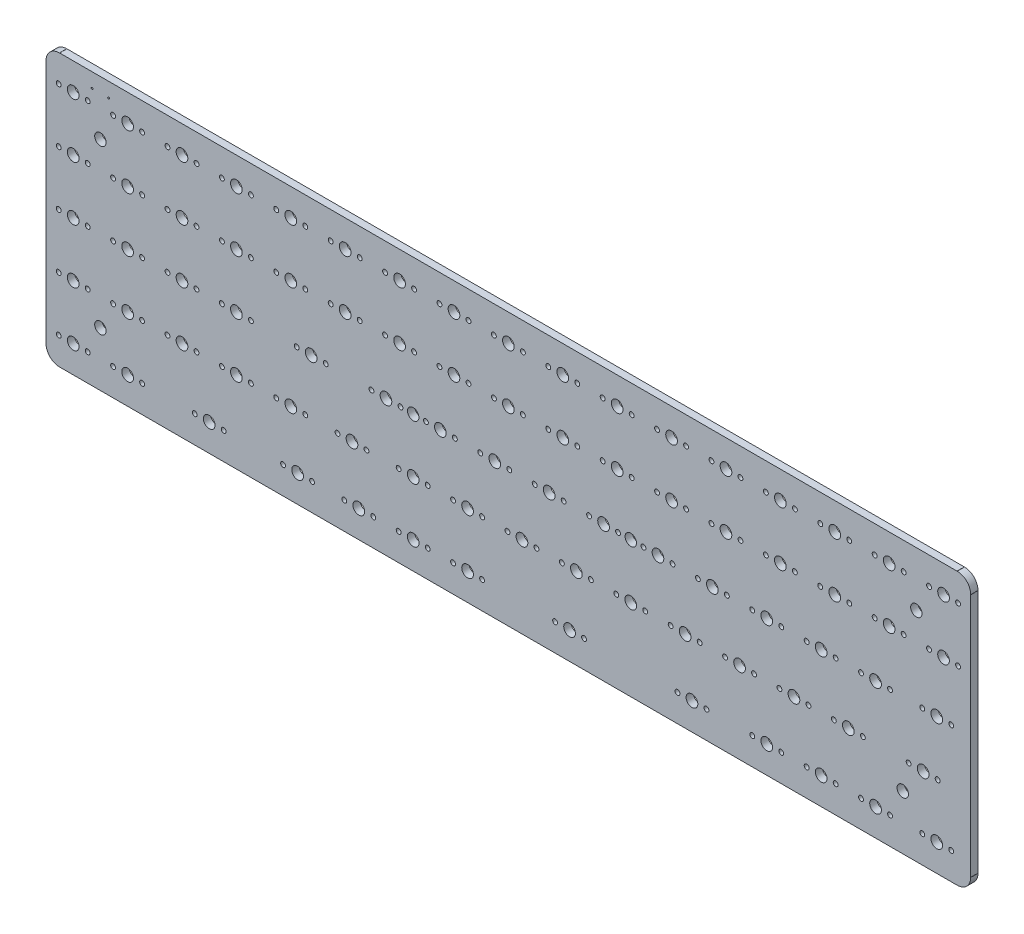
from build123d import *

# Parameters (mm, degrees)
SKETCH2_R           = 0.8534
SKETCH2_R_2         = 2.0447
SKETCH2_R_3         = 2
SKETCH2_R_4         = 0.325
BOSS_EXTRUDE3_DEPTH = 1.27


with BuildPart() as part:
    # Sketch2 → Boss-Extrude3 (new, symmetric)
    with BuildSketch(Plane.XY):
        with BuildLine():
            ThreePointArc((314.2869, -4.7625), (314.298059232, -4.735559232), (314.325, -4.7244))
            Line((314.325, -4.7244), (314.325, 80.9244))
            ThreePointArc((314.325, 80.9244), (314.298059232, 80.935559232), (314.2869, 80.9625))
            ThreePointArc((314.2869, 80.9625), (314.298005094, 80.989386522), (314.324846721, 81.000599692))
            ThreePointArc((314.324846721, 81.000599692), (312.93006375, 84.33006375), (309.600599692, 85.724846721))
            ThreePointArc((309.600599692, 85.724846721), (309.589386522, 85.698005094), (309.5625, 85.6869))
            ThreePointArc((309.5625, 85.6869), (309.535559232, 85.698059232), (309.5244, 85.725))
            Line((309.5244, 85.725), (-4.7244, 85.725))
            ThreePointArc((-4.7244, 85.725), (-4.735559232, 85.698059232), (-4.7625, 85.6869))
            ThreePointArc((-4.7625, 85.6869), (-4.789386522, 85.698005094), (-4.800599692, 85.724846721))
            ThreePointArc((-4.800599692, 85.724846721), (-8.13006375, 84.33006375), (-9.524846721, 81.000599692))
            ThreePointArc((-9.524846721, 81.000599692), (-9.498005094, 80.989386522), (-9.4869, 80.9625))
            ThreePointArc((-9.4869, 80.9625), (-9.498059232, 80.935559232), (-9.525, 80.9244))
            Line((-9.525, 80.9244), (-9.525, -4.7244))
            ThreePointArc((-9.525, -4.7244), (-9.498059232, -4.735559232), (-9.4869, -4.7625))
            ThreePointArc((-9.4869, -4.7625), (-9.498005094, -4.789386522), (-9.524846721, -4.800599692))
            ThreePointArc((-9.524846721, -4.800599692), (-8.13006375, -8.13006375), (-4.800599692, -9.524846721))
            ThreePointArc((-4.800599692, -9.524846721), (-4.789386522, -9.498005094), (-4.7625, -9.4869))
            ThreePointArc((-4.7625, -9.4869), (-4.735559232, -9.498059232), (-4.7244, -9.525))
            Line((-4.7244, -9.525), (309.5244, -9.525))
            ThreePointArc((309.5244, -9.525), (309.535559232, -9.498059232), (309.5625, -9.4869))
            ThreePointArc((309.5625, -9.4869), (309.589386522, -9.498005094), (309.600599692, -9.524846721))
            ThreePointArc((309.600599692, -9.524846721), (312.93006375, -8.13006375), (314.324846721, -4.800599692))
            ThreePointArc((314.324846721, -4.800599692), (314.298005094, -4.789386522), (314.2869, -4.7625))
        make_face()
        with Locations((-5.08, 0)):
            Circle(SKETCH2_R, mode=Mode.SUBTRACT)
        Circle(SKETCH2_R_2, mode=Mode.SUBTRACT)
        with Locations((5.08, 0)):
            Circle(SKETCH2_R, mode=Mode.SUBTRACT)
        with Locations((13.97, 0)):
            Circle(SKETCH2_R, mode=Mode.SUBTRACT)
        with Locations((19.05, 0)):
            Circle(SKETCH2_R_2, mode=Mode.SUBTRACT)
        with Locations((24.13, 0)):
            Circle(SKETCH2_R, mode=Mode.SUBTRACT)
        with Locations((42.545, 0)):
            Circle(SKETCH2_R, mode=Mode.SUBTRACT)
        with Locations((47.625, 0)):
            Circle(SKETCH2_R_2, mode=Mode.SUBTRACT)
        with Locations((52.705, 0)):
            Circle(SKETCH2_R, mode=Mode.SUBTRACT)
        with Locations((9.525, 9.525)):
            Circle(SKETCH2_R_3, mode=Mode.SUBTRACT)
        with Locations((73.5012, 0)):
            Circle(SKETCH2_R, mode=Mode.SUBTRACT)
        with Locations((78.5812, 0)):
            Circle(SKETCH2_R_2, mode=Mode.SUBTRACT)
        with Locations((83.6613, 0)):
            Circle(SKETCH2_R, mode=Mode.SUBTRACT)
        with Locations((94.9325, 0)):
            Circle(SKETCH2_R, mode=Mode.SUBTRACT)
        with Locations((100.0125, 0)):
            Circle(SKETCH2_R_2, mode=Mode.SUBTRACT)
        with Locations((105.0925, 0)):
            Circle(SKETCH2_R, mode=Mode.SUBTRACT)
        with Locations((113.9825, 0)):
            Circle(SKETCH2_R, mode=Mode.SUBTRACT)
        with Locations((119.0625, 0)):
            Circle(SKETCH2_R_2, mode=Mode.SUBTRACT)
        with Locations((124.1425, 0)):
            Circle(SKETCH2_R, mode=Mode.SUBTRACT)
        with Locations((133.0325, 0)):
            Circle(SKETCH2_R, mode=Mode.SUBTRACT)
        with Locations((138.1125, 0)):
            Circle(SKETCH2_R_2, mode=Mode.SUBTRACT)
        with Locations((143.1925, 0)):
            Circle(SKETCH2_R, mode=Mode.SUBTRACT)
        with Locations((-5.08, 19.05)):
            Circle(SKETCH2_R, mode=Mode.SUBTRACT)
        with Locations((0, 19.05)):
            Circle(SKETCH2_R_2, mode=Mode.SUBTRACT)
        with Locations((5.08, 19.05)):
            Circle(SKETCH2_R, mode=Mode.SUBTRACT)
        with Locations((13.97, 19.05)):
            Circle(SKETCH2_R, mode=Mode.SUBTRACT)
        with Locations((19.05, 19.05)):
            Circle(SKETCH2_R_2, mode=Mode.SUBTRACT)
        with Locations((24.13, 19.05)):
            Circle(SKETCH2_R, mode=Mode.SUBTRACT)
        with Locations((33.02, 19.05)):
            Circle(SKETCH2_R, mode=Mode.SUBTRACT)
        with Locations((38.1, 19.05)):
            Circle(SKETCH2_R_2, mode=Mode.SUBTRACT)
        with Locations((43.18, 19.05)):
            Circle(SKETCH2_R, mode=Mode.SUBTRACT)
        with Locations((52.07, 19.05)):
            Circle(SKETCH2_R, mode=Mode.SUBTRACT)
        with Locations((57.15, 19.05)):
            Circle(SKETCH2_R_2, mode=Mode.SUBTRACT)
        with Locations((62.23, 19.05)):
            Circle(SKETCH2_R, mode=Mode.SUBTRACT)
        with Locations((71.12, 19.05)):
            Circle(SKETCH2_R, mode=Mode.SUBTRACT)
        with Locations((76.2, 19.05)):
            Circle(SKETCH2_R_2, mode=Mode.SUBTRACT)
        with Locations((81.28, 19.05)):
            Circle(SKETCH2_R, mode=Mode.SUBTRACT)
        with Locations((92.5513, 19.05)):
            Circle(SKETCH2_R, mode=Mode.SUBTRACT)
        with Locations((97.6313, 19.05)):
            Circle(SKETCH2_R_2, mode=Mode.SUBTRACT)
        with Locations((102.7113, 19.05)):
            Circle(SKETCH2_R, mode=Mode.SUBTRACT)
        with Locations((113.9825, 19.05)):
            Circle(SKETCH2_R, mode=Mode.SUBTRACT)
        with Locations((119.0625, 19.05)):
            Circle(SKETCH2_R_2, mode=Mode.SUBTRACT)
        with Locations((124.1425, 19.05)):
            Circle(SKETCH2_R, mode=Mode.SUBTRACT)
        with Locations((133.0325, 19.05)):
            Circle(SKETCH2_R, mode=Mode.SUBTRACT)
        with Locations((138.1125, 19.05)):
            Circle(SKETCH2_R_2, mode=Mode.SUBTRACT)
        with Locations((143.1925, 19.05)):
            Circle(SKETCH2_R, mode=Mode.SUBTRACT)
        with Locations((152.0825, 19.05)):
            Circle(SKETCH2_R, mode=Mode.SUBTRACT)
        with Locations((168.7512, 0)):
            Circle(SKETCH2_R, mode=Mode.SUBTRACT)
        with Locations((173.8313, 0)):
            Circle(SKETCH2_R_2, mode=Mode.SUBTRACT)
        with Locations((178.9112, 0)):
            Circle(SKETCH2_R, mode=Mode.SUBTRACT)
        with Locations((211.6138, 0)):
            Circle(SKETCH2_R, mode=Mode.SUBTRACT)
        with Locations((216.6938, 0)):
            Circle(SKETCH2_R_2, mode=Mode.SUBTRACT)
        with Locations((221.7738, 0)):
            Circle(SKETCH2_R, mode=Mode.SUBTRACT)
        with Locations((237.8075, 0)):
            Circle(SKETCH2_R, mode=Mode.SUBTRACT)
        with Locations((242.8875, 0)):
            Circle(SKETCH2_R_2, mode=Mode.SUBTRACT)
        with Locations((247.9675, 0)):
            Circle(SKETCH2_R, mode=Mode.SUBTRACT)
        with Locations((256.8575, 0)):
            Circle(SKETCH2_R, mode=Mode.SUBTRACT)
        with Locations((261.9375, 0)):
            Circle(SKETCH2_R_2, mode=Mode.SUBTRACT)
        with Locations((267.0175, 0)):
            Circle(SKETCH2_R, mode=Mode.SUBTRACT)
        with Locations((275.9075, 0)):
            Circle(SKETCH2_R, mode=Mode.SUBTRACT)
        with Locations((280.9875, 0)):
            Circle(SKETCH2_R_2, mode=Mode.SUBTRACT)
        with Locations((286.0675, 0)):
            Circle(SKETCH2_R, mode=Mode.SUBTRACT)
        with Locations((297.3388, 0)):
            Circle(SKETCH2_R, mode=Mode.SUBTRACT)
        with Locations((302.4187, 0)):
            Circle(SKETCH2_R_2, mode=Mode.SUBTRACT)
        with Locations((307.4988, 0)):
            Circle(SKETCH2_R, mode=Mode.SUBTRACT)
        with Locations((290.5125, 9.525)):
            Circle(SKETCH2_R_3, mode=Mode.SUBTRACT)
        with Locations((157.1625, 19.05)):
            Circle(SKETCH2_R_2, mode=Mode.SUBTRACT)
        with Locations((162.2425, 19.05)):
            Circle(SKETCH2_R, mode=Mode.SUBTRACT)
        with Locations((171.1325, 19.05)):
            Circle(SKETCH2_R, mode=Mode.SUBTRACT)
        with Locations((176.2125, 19.05)):
            Circle(SKETCH2_R_2, mode=Mode.SUBTRACT)
        with Locations((181.2925, 19.05)):
            Circle(SKETCH2_R, mode=Mode.SUBTRACT)
        with Locations((190.1825, 19.05)):
            Circle(SKETCH2_R, mode=Mode.SUBTRACT)
        with Locations((195.2625, 19.05)):
            Circle(SKETCH2_R_2, mode=Mode.SUBTRACT)
        with Locations((200.3425, 19.05)):
            Circle(SKETCH2_R, mode=Mode.SUBTRACT)
        with Locations((209.2325, 19.05)):
            Circle(SKETCH2_R, mode=Mode.SUBTRACT)
        with Locations((214.3125, 19.05)):
            Circle(SKETCH2_R_2, mode=Mode.SUBTRACT)
        with Locations((219.3925, 19.05)):
            Circle(SKETCH2_R, mode=Mode.SUBTRACT)
        with Locations((228.2825, 19.05)):
            Circle(SKETCH2_R, mode=Mode.SUBTRACT)
        with Locations((233.3625, 19.05)):
            Circle(SKETCH2_R_2, mode=Mode.SUBTRACT)
        with Locations((238.4425, 19.05)):
            Circle(SKETCH2_R, mode=Mode.SUBTRACT)
        with Locations((247.3325, 19.05)):
            Circle(SKETCH2_R, mode=Mode.SUBTRACT)
        with Locations((252.4125, 19.05)):
            Circle(SKETCH2_R_2, mode=Mode.SUBTRACT)
        with Locations((257.4925, 19.05)):
            Circle(SKETCH2_R, mode=Mode.SUBTRACT)
        with Locations((266.3825, 19.05)):
            Circle(SKETCH2_R, mode=Mode.SUBTRACT)
        with Locations((271.4625, 19.05)):
            Circle(SKETCH2_R_2, mode=Mode.SUBTRACT)
        with Locations((276.5425, 19.05)):
            Circle(SKETCH2_R, mode=Mode.SUBTRACT)
        with Locations((292.5763, 19.05)):
            Circle(SKETCH2_R, mode=Mode.SUBTRACT)
        with Locations((297.6563, 19.05)):
            Circle(SKETCH2_R_2, mode=Mode.SUBTRACT)
        with Locations((302.7363, 19.05)):
            Circle(SKETCH2_R, mode=Mode.SUBTRACT)
        with Locations((-5.08, 38.1)):
            Circle(SKETCH2_R, mode=Mode.SUBTRACT)
        with Locations((0, 38.1)):
            Circle(SKETCH2_R_2, mode=Mode.SUBTRACT)
        with Locations((5.08, 38.1)):
            Circle(SKETCH2_R, mode=Mode.SUBTRACT)
        with Locations((13.97, 38.1)):
            Circle(SKETCH2_R, mode=Mode.SUBTRACT)
        with Locations((19.05, 38.1)):
            Circle(SKETCH2_R_2, mode=Mode.SUBTRACT)
        with Locations((24.13, 38.1)):
            Circle(SKETCH2_R, mode=Mode.SUBTRACT)
        with Locations((33.02, 38.1)):
            Circle(SKETCH2_R, mode=Mode.SUBTRACT)
        with Locations((38.1, 38.1)):
            Circle(SKETCH2_R_2, mode=Mode.SUBTRACT)
        with Locations((43.18, 38.1)):
            Circle(SKETCH2_R, mode=Mode.SUBTRACT)
        with Locations((52.07, 38.1)):
            Circle(SKETCH2_R, mode=Mode.SUBTRACT)
        with Locations((57.15, 38.1)):
            Circle(SKETCH2_R_2, mode=Mode.SUBTRACT)
        with Locations((62.23, 38.1)):
            Circle(SKETCH2_R, mode=Mode.SUBTRACT)
        with Locations((-5.08, 57.15)):
            Circle(SKETCH2_R, mode=Mode.SUBTRACT)
        with Locations((0, 57.15)):
            Circle(SKETCH2_R_2, mode=Mode.SUBTRACT)
        with Locations((5.08, 57.15)):
            Circle(SKETCH2_R, mode=Mode.SUBTRACT)
        with Locations((13.97, 57.15)):
            Circle(SKETCH2_R, mode=Mode.SUBTRACT)
        with Locations((19.05, 57.15)):
            Circle(SKETCH2_R_2, mode=Mode.SUBTRACT)
        with Locations((24.13, 57.15)):
            Circle(SKETCH2_R, mode=Mode.SUBTRACT)
        with Locations((33.02, 57.15)):
            Circle(SKETCH2_R, mode=Mode.SUBTRACT)
        with Locations((38.1, 57.15)):
            Circle(SKETCH2_R_2, mode=Mode.SUBTRACT)
        with Locations((43.18, 57.15)):
            Circle(SKETCH2_R, mode=Mode.SUBTRACT)
        with Locations((52.07, 57.15)):
            Circle(SKETCH2_R, mode=Mode.SUBTRACT)
        with Locations((57.15, 57.15)):
            Circle(SKETCH2_R_2, mode=Mode.SUBTRACT)
        with Locations((62.23, 57.15)):
            Circle(SKETCH2_R, mode=Mode.SUBTRACT)
        with Locations((71.12, 57.15)):
            Circle(SKETCH2_R, mode=Mode.SUBTRACT)
        with Locations((78.2638, 38.1)):
            Circle(SKETCH2_R, mode=Mode.SUBTRACT)
        with Locations((83.3438, 38.1)):
            Circle(SKETCH2_R_2, mode=Mode.SUBTRACT)
        with Locations((88.4237, 38.1)):
            Circle(SKETCH2_R, mode=Mode.SUBTRACT)
        with Locations((104.4575, 38.1)):
            Circle(SKETCH2_R, mode=Mode.SUBTRACT)
        with Locations((109.5375, 38.1)):
            Circle(SKETCH2_R_2, mode=Mode.SUBTRACT)
        with Locations((114.6175, 38.1)):
            Circle(SKETCH2_R, mode=Mode.SUBTRACT)
        with Locations((119.0625, 38.1)):
            Circle(SKETCH2_R_3, mode=Mode.SUBTRACT)
        with Locations((123.5075, 38.1)):
            Circle(SKETCH2_R, mode=Mode.SUBTRACT)
        with Locations((128.5875, 38.1)):
            Circle(SKETCH2_R_2, mode=Mode.SUBTRACT)
        with Locations((133.6675, 38.1)):
            Circle(SKETCH2_R, mode=Mode.SUBTRACT)
        with Locations((142.5575, 38.1)):
            Circle(SKETCH2_R, mode=Mode.SUBTRACT)
        with Locations((147.6375, 38.1)):
            Circle(SKETCH2_R_2, mode=Mode.SUBTRACT)
        with Locations((76.2, 57.15)):
            Circle(SKETCH2_R_2, mode=Mode.SUBTRACT)
        with Locations((81.28, 57.15)):
            Circle(SKETCH2_R, mode=Mode.SUBTRACT)
        with Locations((90.17, 57.15)):
            Circle(SKETCH2_R, mode=Mode.SUBTRACT)
        with Locations((95.25, 57.15)):
            Circle(SKETCH2_R_2, mode=Mode.SUBTRACT)
        with Locations((100.33, 57.15)):
            Circle(SKETCH2_R, mode=Mode.SUBTRACT)
        with Locations((109.22, 57.15)):
            Circle(SKETCH2_R, mode=Mode.SUBTRACT)
        with Locations((114.3, 57.15)):
            Circle(SKETCH2_R_2, mode=Mode.SUBTRACT)
        with Locations((119.38, 57.15)):
            Circle(SKETCH2_R, mode=Mode.SUBTRACT)
        with Locations((128.27, 57.15)):
            Circle(SKETCH2_R, mode=Mode.SUBTRACT)
        with Locations((133.35, 57.15)):
            Circle(SKETCH2_R_2, mode=Mode.SUBTRACT)
        with Locations((138.43, 57.15)):
            Circle(SKETCH2_R, mode=Mode.SUBTRACT)
        with Locations((147.32, 57.15)):
            Circle(SKETCH2_R, mode=Mode.SUBTRACT)
        with Locations((9.525, 66.675)):
            Circle(SKETCH2_R_3, mode=Mode.SUBTRACT)
        with Locations((-5.08, 76.2)):
            Circle(SKETCH2_R, mode=Mode.SUBTRACT)
        with Locations((0, 76.2)):
            Circle(SKETCH2_R_2, mode=Mode.SUBTRACT)
        with Locations((5.08, 76.2)):
            Circle(SKETCH2_R, mode=Mode.SUBTRACT)
        with Locations((13.97, 76.2)):
            Circle(SKETCH2_R, mode=Mode.SUBTRACT)
        with Locations((19.05, 76.2)):
            Circle(SKETCH2_R_2, mode=Mode.SUBTRACT)
        with Locations((24.13, 76.2)):
            Circle(SKETCH2_R, mode=Mode.SUBTRACT)
        with Locations((6.635, 80.6463)):
            Circle(SKETCH2_R_4, mode=Mode.SUBTRACT)
        with Locations((12.415, 80.6463)):
            Circle(SKETCH2_R_4, mode=Mode.SUBTRACT)
        with Locations((33.02, 76.2)):
            Circle(SKETCH2_R, mode=Mode.SUBTRACT)
        with Locations((38.1, 76.2)):
            Circle(SKETCH2_R_2, mode=Mode.SUBTRACT)
        with Locations((43.18, 76.2)):
            Circle(SKETCH2_R, mode=Mode.SUBTRACT)
        with Locations((52.07, 76.2)):
            Circle(SKETCH2_R, mode=Mode.SUBTRACT)
        with Locations((57.15, 76.2)):
            Circle(SKETCH2_R_2, mode=Mode.SUBTRACT)
        with Locations((62.23, 76.2)):
            Circle(SKETCH2_R, mode=Mode.SUBTRACT)
        with Locations((71.12, 76.2)):
            Circle(SKETCH2_R, mode=Mode.SUBTRACT)
        with Locations((76.2, 76.2)):
            Circle(SKETCH2_R_2, mode=Mode.SUBTRACT)
        with Locations((81.28, 76.2)):
            Circle(SKETCH2_R, mode=Mode.SUBTRACT)
        with Locations((90.17, 76.2)):
            Circle(SKETCH2_R, mode=Mode.SUBTRACT)
        with Locations((95.25, 76.2)):
            Circle(SKETCH2_R_2, mode=Mode.SUBTRACT)
        with Locations((100.33, 76.2)):
            Circle(SKETCH2_R, mode=Mode.SUBTRACT)
        with Locations((109.22, 76.2)):
            Circle(SKETCH2_R, mode=Mode.SUBTRACT)
        with Locations((114.3, 76.2)):
            Circle(SKETCH2_R_2, mode=Mode.SUBTRACT)
        with Locations((119.38, 76.2)):
            Circle(SKETCH2_R, mode=Mode.SUBTRACT)
        with Locations((128.27, 76.2)):
            Circle(SKETCH2_R, mode=Mode.SUBTRACT)
        with Locations((133.35, 76.2)):
            Circle(SKETCH2_R_2, mode=Mode.SUBTRACT)
        with Locations((138.43, 76.2)):
            Circle(SKETCH2_R, mode=Mode.SUBTRACT)
        with Locations((147.32, 76.2)):
            Circle(SKETCH2_R, mode=Mode.SUBTRACT)
        with Locations((152.7175, 38.1)):
            Circle(SKETCH2_R, mode=Mode.SUBTRACT)
        with Locations((161.6075, 38.1)):
            Circle(SKETCH2_R, mode=Mode.SUBTRACT)
        with Locations((166.6875, 38.1)):
            Circle(SKETCH2_R_2, mode=Mode.SUBTRACT)
        with Locations((171.7675, 38.1)):
            Circle(SKETCH2_R, mode=Mode.SUBTRACT)
        with Locations((180.6575, 38.1)):
            Circle(SKETCH2_R, mode=Mode.SUBTRACT)
        with Locations((185.7375, 38.1)):
            Circle(SKETCH2_R_2, mode=Mode.SUBTRACT)
        with Locations((190.8175, 38.1)):
            Circle(SKETCH2_R, mode=Mode.SUBTRACT)
        with Locations((195.2625, 38.1)):
            Circle(SKETCH2_R_3, mode=Mode.SUBTRACT)
        with Locations((199.7075, 38.1)):
            Circle(SKETCH2_R, mode=Mode.SUBTRACT)
        with Locations((204.7875, 38.1)):
            Circle(SKETCH2_R_2, mode=Mode.SUBTRACT)
        with Locations((209.8675, 38.1)):
            Circle(SKETCH2_R, mode=Mode.SUBTRACT)
        with Locations((218.7575, 38.1)):
            Circle(SKETCH2_R, mode=Mode.SUBTRACT)
        with Locations((223.8375, 38.1)):
            Circle(SKETCH2_R_2, mode=Mode.SUBTRACT)
        with Locations((228.9175, 38.1)):
            Circle(SKETCH2_R, mode=Mode.SUBTRACT)
        with Locations((152.4, 57.15)):
            Circle(SKETCH2_R_2, mode=Mode.SUBTRACT)
        with Locations((157.48, 57.15)):
            Circle(SKETCH2_R, mode=Mode.SUBTRACT)
        with Locations((166.37, 57.15)):
            Circle(SKETCH2_R, mode=Mode.SUBTRACT)
        with Locations((171.45, 57.15)):
            Circle(SKETCH2_R_2, mode=Mode.SUBTRACT)
        with Locations((176.53, 57.15)):
            Circle(SKETCH2_R, mode=Mode.SUBTRACT)
        with Locations((185.42, 57.15)):
            Circle(SKETCH2_R, mode=Mode.SUBTRACT)
        with Locations((190.5, 57.15)):
            Circle(SKETCH2_R_2, mode=Mode.SUBTRACT)
        with Locations((195.58, 57.15)):
            Circle(SKETCH2_R, mode=Mode.SUBTRACT)
        with Locations((204.47, 57.15)):
            Circle(SKETCH2_R, mode=Mode.SUBTRACT)
        with Locations((209.55, 57.15)):
            Circle(SKETCH2_R_2, mode=Mode.SUBTRACT)
        with Locations((214.63, 57.15)):
            Circle(SKETCH2_R, mode=Mode.SUBTRACT)
        with Locations((223.52, 57.15)):
            Circle(SKETCH2_R, mode=Mode.SUBTRACT)
        with Locations((228.6, 57.15)):
            Circle(SKETCH2_R_2, mode=Mode.SUBTRACT)
        with Locations((237.8075, 38.1)):
            Circle(SKETCH2_R, mode=Mode.SUBTRACT)
        with Locations((242.8875, 38.1)):
            Circle(SKETCH2_R_2, mode=Mode.SUBTRACT)
        with Locations((247.9675, 38.1)):
            Circle(SKETCH2_R, mode=Mode.SUBTRACT)
        with Locations((256.8575, 38.1)):
            Circle(SKETCH2_R, mode=Mode.SUBTRACT)
        with Locations((261.9375, 38.1)):
            Circle(SKETCH2_R_2, mode=Mode.SUBTRACT)
        with Locations((267.0175, 38.1)):
            Circle(SKETCH2_R, mode=Mode.SUBTRACT)
        with Locations((275.9075, 38.1)):
            Circle(SKETCH2_R, mode=Mode.SUBTRACT)
        with Locations((280.9875, 38.1)):
            Circle(SKETCH2_R_2, mode=Mode.SUBTRACT)
        with Locations((286.0675, 38.1)):
            Circle(SKETCH2_R, mode=Mode.SUBTRACT)
        with Locations((297.3388, 38.1)):
            Circle(SKETCH2_R, mode=Mode.SUBTRACT)
        with Locations((302.4187, 38.1)):
            Circle(SKETCH2_R_2, mode=Mode.SUBTRACT)
        with Locations((307.4988, 38.1)):
            Circle(SKETCH2_R, mode=Mode.SUBTRACT)
        with Locations((233.68, 57.15)):
            Circle(SKETCH2_R, mode=Mode.SUBTRACT)
        with Locations((242.57, 57.15)):
            Circle(SKETCH2_R, mode=Mode.SUBTRACT)
        with Locations((247.65, 57.15)):
            Circle(SKETCH2_R_2, mode=Mode.SUBTRACT)
        with Locations((252.73, 57.15)):
            Circle(SKETCH2_R, mode=Mode.SUBTRACT)
        with Locations((261.62, 57.15)):
            Circle(SKETCH2_R, mode=Mode.SUBTRACT)
        with Locations((266.7, 57.15)):
            Circle(SKETCH2_R_2, mode=Mode.SUBTRACT)
        with Locations((271.78, 57.15)):
            Circle(SKETCH2_R, mode=Mode.SUBTRACT)
        with Locations((280.67, 57.15)):
            Circle(SKETCH2_R, mode=Mode.SUBTRACT)
        with Locations((285.75, 57.15)):
            Circle(SKETCH2_R_2, mode=Mode.SUBTRACT)
        with Locations((290.83, 57.15)):
            Circle(SKETCH2_R, mode=Mode.SUBTRACT)
        with Locations((299.72, 57.15)):
            Circle(SKETCH2_R, mode=Mode.SUBTRACT)
        with Locations((304.8, 57.15)):
            Circle(SKETCH2_R_2, mode=Mode.SUBTRACT)
        with Locations((309.88, 57.15)):
            Circle(SKETCH2_R, mode=Mode.SUBTRACT)
        with Locations((152.4, 76.2)):
            Circle(SKETCH2_R_2, mode=Mode.SUBTRACT)
        with Locations((157.48, 76.2)):
            Circle(SKETCH2_R, mode=Mode.SUBTRACT)
        with Locations((166.37, 76.2)):
            Circle(SKETCH2_R, mode=Mode.SUBTRACT)
        with Locations((171.45, 76.2)):
            Circle(SKETCH2_R_2, mode=Mode.SUBTRACT)
        with Locations((176.53, 76.2)):
            Circle(SKETCH2_R, mode=Mode.SUBTRACT)
        with Locations((185.42, 76.2)):
            Circle(SKETCH2_R, mode=Mode.SUBTRACT)
        with Locations((190.5, 76.2)):
            Circle(SKETCH2_R_2, mode=Mode.SUBTRACT)
        with Locations((195.58, 76.2)):
            Circle(SKETCH2_R, mode=Mode.SUBTRACT)
        with Locations((204.47, 76.2)):
            Circle(SKETCH2_R, mode=Mode.SUBTRACT)
        with Locations((209.55, 76.2)):
            Circle(SKETCH2_R_2, mode=Mode.SUBTRACT)
        with Locations((214.63, 76.2)):
            Circle(SKETCH2_R, mode=Mode.SUBTRACT)
        with Locations((223.52, 76.2)):
            Circle(SKETCH2_R, mode=Mode.SUBTRACT)
        with Locations((228.6, 76.2)):
            Circle(SKETCH2_R_2, mode=Mode.SUBTRACT)
        with Locations((295.275, 66.675)):
            Circle(SKETCH2_R_3, mode=Mode.SUBTRACT)
        with Locations((233.68, 76.2)):
            Circle(SKETCH2_R, mode=Mode.SUBTRACT)
        with Locations((242.57, 76.2)):
            Circle(SKETCH2_R, mode=Mode.SUBTRACT)
        with Locations((247.65, 76.2)):
            Circle(SKETCH2_R_2, mode=Mode.SUBTRACT)
        with Locations((252.73, 76.2)):
            Circle(SKETCH2_R, mode=Mode.SUBTRACT)
        with Locations((261.62, 76.2)):
            Circle(SKETCH2_R, mode=Mode.SUBTRACT)
        with Locations((266.7, 76.2)):
            Circle(SKETCH2_R_2, mode=Mode.SUBTRACT)
        with Locations((271.78, 76.2)):
            Circle(SKETCH2_R, mode=Mode.SUBTRACT)
        with Locations((280.67, 76.2)):
            Circle(SKETCH2_R, mode=Mode.SUBTRACT)
        with Locations((285.75, 76.2)):
            Circle(SKETCH2_R_2, mode=Mode.SUBTRACT)
        with Locations((290.83, 76.2)):
            Circle(SKETCH2_R, mode=Mode.SUBTRACT)
        with Locations((299.72, 76.2)):
            Circle(SKETCH2_R, mode=Mode.SUBTRACT)
        with Locations((304.8, 76.2)):
            Circle(SKETCH2_R_2, mode=Mode.SUBTRACT)
        with Locations((309.88, 76.2)):
            Circle(SKETCH2_R, mode=Mode.SUBTRACT)
    extrude(amount=BOSS_EXTRUDE3_DEPTH, both=True)


solid = part.part
